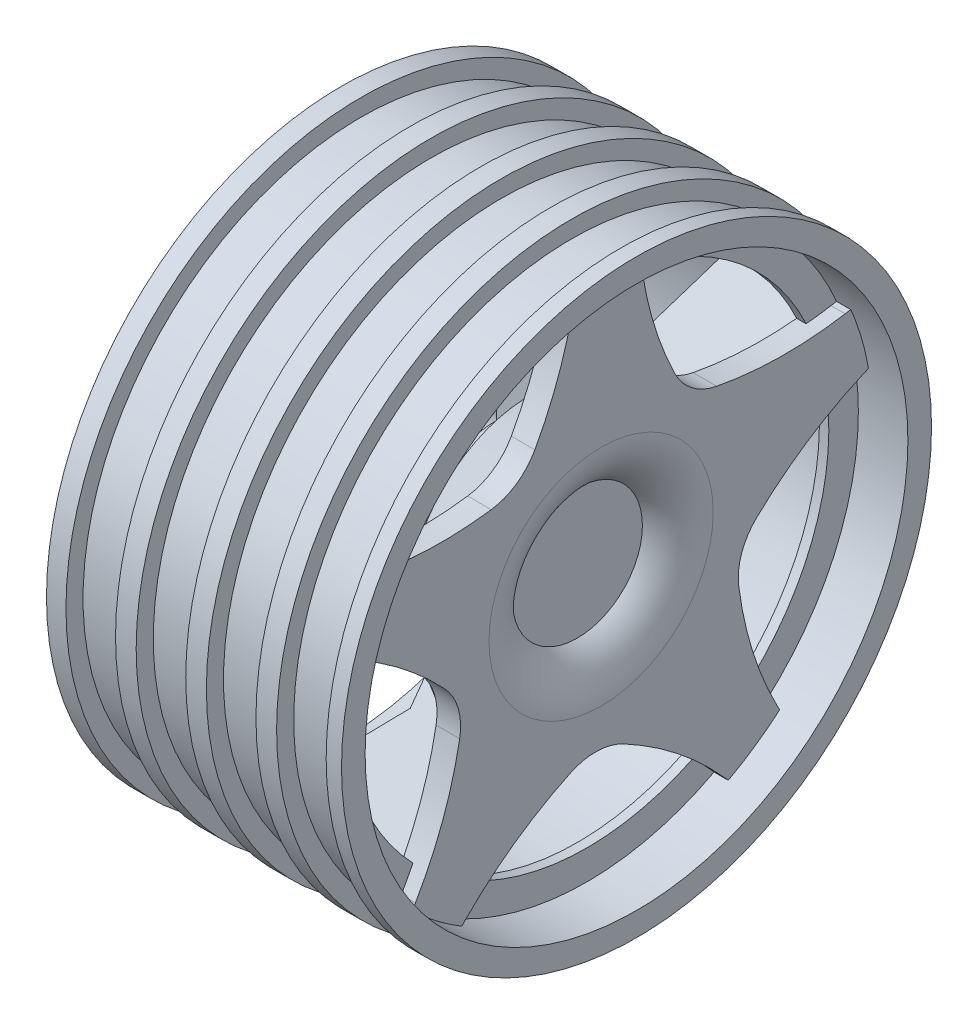
from build123d import *

# Parameters (mm, degrees)
CROQUIS1_R              = 25
SALIENTE_EXTRUIR1_DEPTH = 30
CROQUIS2_R              = 25
CROQUIS2_R_2            = 5.5
CROQUIS2_R_3            = 23
CORTAR_EXTRUIR1_DEPTH   = 5
CORTAR_EXTRUIR2_DEPTH   = 14
CROQUIS2_4_R            = 23
CROQUIS2_4_R_2          = 5.5
CORTAR_EXTRUIR3_DEPTH   = 25
CORTAR_EXTRUIR4_START   = -4.2
CROQUIS4_R              = 23
CORTAR_EXTRUIR4_DEPTH   = 4.2
CROQUIS5_R              = 20.5
CORTAR_EXTRUIR5_DEPTH   = 0.8
CROQUIS6_OUTSIDE_W      = 67.362
CROQUIS6_OUTSIDE_H      = 67.362
CROQUIS6_OUTSIDE_R      = 23.55
CORTAR_EXTRUIR7_DEPTH   = 4.2
CROQUIS7_OUTSIDE_W      = 67.362
CROQUIS7_OUTSIDE_H      = 67.362
CROQUIS7_OUTSIDE_R      = 23.55
CORTAR_EXTRUIR8_DEPTH   = 4.2
CROQUIS8_OUTSIDE_W      = 67.362
CROQUIS8_OUTSIDE_H      = 67.362
CROQUIS8_OUTSIDE_R      = 23.55
CORTAR_EXTRUIR9_DEPTH   = 4.2
CROQUIS9_OUTSIDE_W      = 67.362
CROQUIS9_OUTSIDE_H      = 67.362
CROQUIS9_OUTSIDE_R      = 23.55
CORTAR_EXTRUIR10_DEPTH  = 4.2
SALIENTE_EXTRUIR2_DEPTH = 2
MATRIZC1_COUNT          = 5
CROQUIS10_3_R           = 11.5
CROQUIS10_3_R_2         = 5.5
SALIENTE_EXTRUIR3_DEPTH = 2
REDONDEO1_R             = 31
REDONDEO2_R             = 5
CROQUIS11_R             = 12.633856274
SALIENTE_EXTRUIR4_DEPTH = 4
SALIENTE_EXTRUIR4_TAPER = 30
CROQUIS11_3_R           = 7.125
SALIENTE_EXTRUIR5_DEPTH = 7.35
REDONDEO3_R             = 1
SALIENTE_EXTRUIR6_DEPTH = 9
MATRIZC2_COUNT          = 5
CORTAR_EXTRUIR11_DEPTH  = 1
MATRIZC3_COUNT          = 5


with BuildPart() as part:
    # Croquis1 → Saliente-Extruir1 (new body)
    with BuildSketch(Plane(origin=(0, 0, 0), x_dir=(0, 0, -1), z_dir=(1, 0, 0))):
        Circle(CROQUIS1_R)
    extrude(amount=SALIENTE_EXTRUIR1_DEPTH)

    # Croquis2 → Cortar-Extruir1 (cut)
    # profile 1 of 2: a face of its own
    with BuildSketch(Plane.ZY):
        Circle(CROQUIS2_R)
        Circle(CROQUIS2_R_2, mode=Mode.SUBTRACT)
    # profile 2 of 2: a face of its own
    with BuildSketch(Plane.ZY):
        Circle(CROQUIS2_R_3)
        Circle(CROQUIS2_R_2, mode=Mode.SUBTRACT)
    extrude(amount=-CORTAR_EXTRUIR1_DEPTH, mode=Mode.SUBTRACT)

    # Croquis2<3> → Cortar-Extruir2 (cut)
    with BuildSketch(Plane.ZY):
        with BuildLine():
            Line((-2.236067977, -2), (2.236067977, -2))
            ThreePointArc((2.236067977, -2), (3, 0), (2.236067977, 2))
            Line((2.236067977, 2), (-2.236067977, 2))
            ThreePointArc((-2.236067977, 2), (-3, 0), (-2.236067977, -2))
        make_face()
    extrude(amount=-CORTAR_EXTRUIR2_DEPTH, mode=Mode.SUBTRACT)

    # Croquis2<4> → Cortar-Extruir3 (cut)
    with BuildSketch(Plane.ZY):
        Circle(CROQUIS2_4_R)
        Circle(CROQUIS2_4_R_2, mode=Mode.SUBTRACT)
    extrude(amount=-CORTAR_EXTRUIR3_DEPTH, mode=Mode.SUBTRACT)

    # Croquis4 → Cortar-Extruir4 (cut)
    with BuildSketch(Plane(origin=(30, 0, 0), x_dir=(0, 0, -1), z_dir=(1, 0, 0)).offset(CORTAR_EXTRUIR4_START)):
        with Locations(Location((0, 0, 0), (0, 0, 180))):
            Circle(CROQUIS4_R)
    extrude(amount=CORTAR_EXTRUIR4_DEPTH, mode=Mode.SUBTRACT)

    # Croquis5 → Cortar-Extruir5 (cut)
    with BuildSketch(Plane(origin=(25.8, 0, 0), x_dir=(0, 0, -1), z_dir=(1, 0, 0))):
        Circle(CROQUIS5_R)
    extrude(amount=-CORTAR_EXTRUIR5_DEPTH, mode=Mode.SUBTRACT)


with BuildPart() as cortar_extruir5_piece_1:
    # of the separate pieces the step leaves, piece 1, a body of its own (cortar_extruir5_pieces)
    add(part.part.solids().sort_by_distance((5, 0, -25))[0])

    # Croquis6 outside → Cortar-Extruir7 (cut)
    with BuildSketch(Plane(origin=(28.7, 0, 0), x_dir=(0, 0, -1), z_dir=(1, 0, 0))):
        Rectangle(CROQUIS6_OUTSIDE_W, CROQUIS6_OUTSIDE_H)
        Circle(CROQUIS6_OUTSIDE_R, mode=Mode.SUBTRACT)
    extrude(amount=-CORTAR_EXTRUIR7_DEPTH, mode=Mode.SUBTRACT)

    # Croquis7 outside → Cortar-Extruir8 (cut)
    with BuildSketch(Plane(origin=(6.65, 0, 0), x_dir=(0, 0, -1), z_dir=(1, 0, 0))):
        Rectangle(CROQUIS7_OUTSIDE_W, CROQUIS7_OUTSIDE_H)
        Circle(CROQUIS7_OUTSIDE_R, mode=Mode.SUBTRACT)
    extrude(amount=CORTAR_EXTRUIR8_DEPTH, mode=Mode.SUBTRACT)

    # Croquis8 outside → Cortar-Extruir9 (cut)
    with BuildSketch(Plane(origin=(12.6, 0, 0), x_dir=(0, 0, -1), z_dir=(1, 0, 0))):
        Rectangle(CROQUIS8_OUTSIDE_W, CROQUIS8_OUTSIDE_H)
        Circle(CROQUIS8_OUTSIDE_R, mode=Mode.SUBTRACT)
    extrude(amount=CORTAR_EXTRUIR9_DEPTH, mode=Mode.SUBTRACT)

    # Croquis9 outside → Cortar-Extruir10 (cut)
    with BuildSketch(Plane(origin=(18.55, 0, 0), x_dir=(0, 0, -1), z_dir=(1, 0, 0))):
        Rectangle(CROQUIS9_OUTSIDE_W, CROQUIS9_OUTSIDE_H)
        Circle(CROQUIS9_OUTSIDE_R, mode=Mode.SUBTRACT)
    extrude(amount=CORTAR_EXTRUIR10_DEPTH, mode=Mode.SUBTRACT)

    # Croquis10 → Saliente-Extruir2 (add)
    with BuildSketch(Plane(origin=(25, 0, 0), x_dir=(0, 0, -1), z_dir=(1, 0, 0))):
        with BuildLine():
            Line((3.210797168, 22.992538826), (-2.039202832, 22.992538826))
            Line((-2.039202832, 22.992538826), (-3.869996761, 10.829271678))
            ThreePointArc((-3.869996761, 10.829271678), (0.307816924, 11.495879642), (4.443971183, 10.606654521))
            Line((4.443971183, 10.606654521), (3.210797168, 22.992538826))
        make_face()
    saliente_extruir2 = extrude(amount=SALIENTE_EXTRUIR2_DEPTH)

    # MatrizC1: Saliente-Extruir2 ×5 about axis
    matrizc1_axis = Axis((0, 0, 0), (1, 0, 0))
    for i in range(1, MATRIZC1_COUNT):
        add(saliente_extruir2.rotate(matrizc1_axis, i * 360 / MATRIZC1_COUNT))

    # Croquis10<3> → Saliente-Extruir3 (add)
    with BuildSketch(Plane(origin=(25, 0, 0), x_dir=(0, 0, -1), z_dir=(1, 0, 0))):
        Circle(CROQUIS10_3_R)
        with Locations(Location((0, 0, 0), (0, 0, 180))):
            Circle(CROQUIS10_3_R_2, mode=Mode.SUBTRACT)
    extrude(amount=SALIENTE_EXTRUIR3_DEPTH)

    # Redondeo1
    # the kernel refuses this fillet: 31 mm, written as the material it adds along each edge
    with BuildSketch(Plane(origin=(25, 7.504104252, 8.71426528), x_dir=(0, 0.21327263759932888, 0.9769927236430297), z_dir=(1, 0, 0)), Plane(origin=(25, -5.968863038, 9.829683313), x_dir=(0, -0.863270426740292, 0.5047416867226584), z_dir=(1, 0, 0)), Plane(origin=(25, -11.193064484, -2.639186894), x_dir=(0, -0.746803102807455, -0.6650452057094749), z_dir=(1, 0, 0)), Plane(origin=(25, -0.948831252, -11.460790516), x_dir=(0, 0.4017207263014023, -0.9157622279062803), z_dir=(1, 0, 0)), Plane(origin=(25, 10.606654521, -4.443971183), x_dir=(0, 0.9950801656470155, 0.09907302325006667), z_dir=(1, 0, 0))) as redondeo1_piece_1:
        with BuildLine():
            CenterArc((11.702647812, -31), REDONDEO1_R, 90, 30.886392543)
            ThreePointArc((-4.210813185, -4.396207806), (-1.809235446, -2.481785072), (0, 0))
            Line((0, 0), (11.702647812, 0))
        make_face()
    extrude(amount=2)
    with BuildSketch(Plane(origin=(25, 10.829271678, 3.869996761), x_dir=(0, 0.988861042913438, -0.1488416534715592), z_dir=(1, 0, 0)), Plane(origin=(25, -0.334156653, 11.495144163), x_dir=(0, 0.4471316917658587, 0.8944681381796677), z_dir=(1, 0, 0)), Plane(origin=(25, -11.035791847, 3.234393037), x_dir=(0, -0.712518459954896, 0.7016533647204318), z_dir=(1, 0, 0)), Plane(origin=(25, -6.486337801, -9.496179333), x_dir=(0, -0.8874923176297151, -0.4608225104617144), z_dir=(1, 0, 0)), Plane(origin=(25, 7.027014623, -9.103354628), x_dir=(0, 0.16401804290531427, -0.9864573389668256), z_dir=(1, 0, 0))) as redondeo1_piece_2:
        with BuildLine():
            CenterArc((11.74129553, 31), REDONDEO1_R, 239.023894597, 30.976105403)
            ThreePointArc((-4.213801756, 4.421157463), (-1.808028666, 2.495433605), (0, 0))
            Line((0, 0), (11.74129553, 0))
        make_face()
    extrude(amount=2)

    # Redondeo2
    # the kernel refuses this fillet: 5 mm, written as the material it adds along each edge
    with BuildSketch(Plane(origin=(27, 10.008965638, 6.883637699), x_dir=(0, 0.856478783009117, -0.5161822296972474), z_dir=(-1, 0, 0)), Plane(origin=(27, -3.453788011, 11.646253024), x_dir=(0, 0.7555849724203418, 0.6550506464789966), z_dir=(-1, 0, 0))) as redondeo2_piece_1:
        with BuildLine():
            CenterArc((2.26686901, -4.996044376), REDONDEO2_R, 87.720766864, 53.369170945)
            ThreePointArc((-1.623795264, -1.855545767), (-0.830353525, -0.91162206), (0, 0))
            ThreePointArc((0, 0), (1.232858584, 0.024524867), (2.465717168, 0))
        make_face()
    extrude(amount=2)
    with BuildSketch(Plane(origin=(27, -12.143524019, 0.314142511), x_dir=(0, -0.4366010392140882, -0.8996552298281704), z_dir=(-1, 0, 0)), Plane(origin=(27, -4.051322576, -11.452102275), x_dir=(0, 0.7207058278680213, -0.6932410184611626), z_dir=(-1, 0, 0)), Plane(origin=(27, 9.639668968, -7.39193096), x_dir=(0, 0.8820217367267648, 0.47120871802366077), z_dir=(-1, 0, 0))) as redondeo2_piece_2:
        with BuildLine():
            CenterArc((2.26686901, 4.996044376), REDONDEO2_R, 218.910062191, 53.369170945)
            ThreePointArc((-1.623795264, 1.855545767), (-0.830353525, 0.91162206), (0, 0))
            ThreePointArc((0, 0), (1.232858584, -0.024524867), (2.465717168, 0))
        make_face()
    extrude(amount=2)
    # the kernel refuses this fillet: 5 mm, written as the material it takes off along each edge
    with BuildSketch(Plane(origin=(27, 0, 0), x_dir=(0, 0, 1), z_dir=(0, 1, 0))) as redondeo2_2_piece_1:
        with BuildLine():
            CenterArc((9.5, -5), REDONDEO2_R, 90, 53.130102354)
            Line((9.5, 0), (5.5, 0))
            Line((5.5, 0), (5.5, -2))
        make_face()
    revolve(axis=Axis((27, 0, 0), (1, 0, 0)), mode=Mode.SUBTRACT)



with BuildPart() as cortar_extruir5_piece_2:
    # of the separate pieces the step leaves, piece 2, a body of its own (cortar_extruir5_pieces)
    add(part.part.solids().sort_by_distance((25, 0, 5.5))[0])


with BuildPart() as cortar_extruir5_piece_1_1:
    add(cortar_extruir5_piece_1.part)

    add(cortar_extruir5_piece_2.part)  # Saliente-Extruir4 merges Cortar-Extruir5 piece 2
    # Croquis11 → Saliente-Extruir4 (add)
    with BuildSketch(Plane.ZY.offset(-25)):
        Circle(CROQUIS11_R)
    extrude(amount=SALIENTE_EXTRUIR4_DEPTH, taper=SALIENTE_EXTRUIR4_TAPER)

    # Croquis11<3> → Saliente-Extruir5 (add)
    with BuildSketch(Plane.ZY.offset(-25)):
        Circle(CROQUIS11_3_R)
    extrude(amount=SALIENTE_EXTRUIR5_DEPTH)

    # Redondeo3
    redondeo3_edges = [cortar_extruir5_piece_1_1.edges().sort_by_distance(p)[0] for p in [
        (17.65, 0, -7.125),
    ]]
    fillet(redondeo3_edges, radius=REDONDEO3_R)

    # Croquis11<5> → Saliente-Extruir6 (add)
    with BuildSketch(Plane.ZY.offset(-25)):
        Polygon((-0.5, 12.623958347), (-0.5, 7.107434488), (0.5, 7.107434488), (0.5, 12.623958347), (0.5, 23), (-0.5, 23), align=None)
    saliente_extruir6 = extrude(amount=SALIENTE_EXTRUIR6_DEPTH)

    # MatrizC2: Saliente-Extruir6 ×5 about axis
    matrizc2_axis = Axis((0, 0, 0), (1, 0, 0))
    for i in range(1, MATRIZC2_COUNT):
        add(saliente_extruir6.rotate(matrizc2_axis, i * 360 / MATRIZC2_COUNT))

    # Croquis12 → Cortar-Extruir11 (cut)
    with BuildSketch(Plane(origin=(0, -0.475528258, 0.154508497), x_dir=(1, 0, 0), z_dir=(0, -0.9510565162951437, 0.3090169943749781))):
        Polygon((18.65, 7.107434488), (18.65, 12.623958347), (16, 15.994564575), (16, 7.107434488), align=None)
    cortar_extruir11 = extrude(amount=-CORTAR_EXTRUIR11_DEPTH, mode=Mode.SUBTRACT)

    # MatrizC3: Cortar-Extruir11 ×5 about axis
    matrizc3_axis = Axis((0, 0, 0), (1, 0, 0))
    for i in range(1, MATRIZC3_COUNT):
        add(cortar_extruir11.rotate(matrizc3_axis, i * 360 / MATRIZC3_COUNT), mode=Mode.SUBTRACT)


solid = cortar_extruir5_piece_1_1.part
